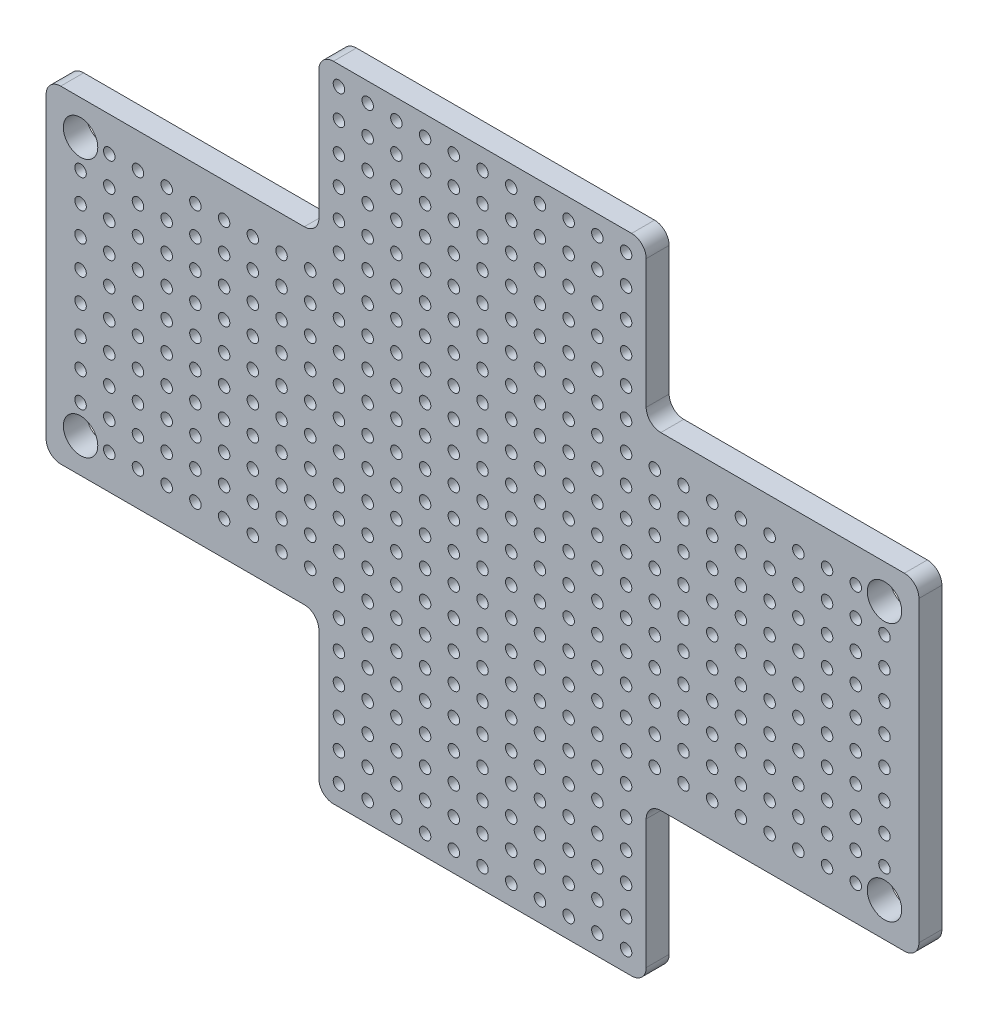
from build123d import *

# Parameters (mm, degrees)
SKETCH1_R           = 1.5
SKETCH1_R_2         = 0.5
BOSS_EXTRUDE1_DEPTH = 2
FILLET2_R           = 1.27


with BuildPart() as part:
    # Sketch1 → Boss-Extrude1 (new body)
    with BuildSketch(Plane.XY):
        Polygon((0, 0), (23.75, 0), (23.75, -13.75), (52.25, -13.75), (52.25, 0), (76, 0), (76, 28.5), (52.25, 28.5), (52.25, 42.25), (23.75, 42.25), (23.75, 28.5), (0, 28.5), align=None)
        with Locations((3, 25.5)):
            Circle(SKETCH1_R, mode=Mode.SUBTRACT)
        with Locations((73, 25.5)):
            Circle(SKETCH1_R, mode=Mode.SUBTRACT)
        with Locations((3, 3)):
            Circle(SKETCH1_R, mode=Mode.SUBTRACT)
        with Locations((73, 3)):
            Circle(SKETCH1_R, mode=Mode.SUBTRACT)
        with Locations((28, 38.04)):
            Circle(SKETCH1_R_2, mode=Mode.SUBTRACT)
        with Locations((5.5, 3)):
            Circle(SKETCH1_R_2, mode=Mode.SUBTRACT)
        with Locations((8, 3)):
            Circle(SKETCH1_R_2, mode=Mode.SUBTRACT)
        with Locations((10.5, 3)):
            Circle(SKETCH1_R_2, mode=Mode.SUBTRACT)
        with Locations((13, 3)):
            Circle(SKETCH1_R_2, mode=Mode.SUBTRACT)
        with Locations((15.5, 3)):
            Circle(SKETCH1_R_2, mode=Mode.SUBTRACT)
        with Locations((18, 3)):
            Circle(SKETCH1_R_2, mode=Mode.SUBTRACT)
        with Locations((20.5, 3)):
            Circle(SKETCH1_R_2, mode=Mode.SUBTRACT)
        with Locations((23, 3)):
            Circle(SKETCH1_R_2, mode=Mode.SUBTRACT)
        with Locations((25.5, 3)):
            Circle(SKETCH1_R_2, mode=Mode.SUBTRACT)
        with Locations((28, 3)):
            Circle(SKETCH1_R_2, mode=Mode.SUBTRACT)
        with Locations((30.5, 3)):
            Circle(SKETCH1_R_2, mode=Mode.SUBTRACT)
        with Locations((33, 3)):
            Circle(SKETCH1_R_2, mode=Mode.SUBTRACT)
        with Locations((35.5, 3)):
            Circle(SKETCH1_R_2, mode=Mode.SUBTRACT)
        with Locations((38, 3)):
            Circle(SKETCH1_R_2, mode=Mode.SUBTRACT)
        with Locations((40.5, 3)):
            Circle(SKETCH1_R_2, mode=Mode.SUBTRACT)
        with Locations((43, 3)):
            Circle(SKETCH1_R_2, mode=Mode.SUBTRACT)
        with Locations((45.5, 3)):
            Circle(SKETCH1_R_2, mode=Mode.SUBTRACT)
        with Locations((48, 3)):
            Circle(SKETCH1_R_2, mode=Mode.SUBTRACT)
        with Locations((50.5, 3)):
            Circle(SKETCH1_R_2, mode=Mode.SUBTRACT)
        with Locations((53, 3)):
            Circle(SKETCH1_R_2, mode=Mode.SUBTRACT)
        with Locations((55.5, 3)):
            Circle(SKETCH1_R_2, mode=Mode.SUBTRACT)
        with Locations((58, 3)):
            Circle(SKETCH1_R_2, mode=Mode.SUBTRACT)
        with Locations((60.5, 3)):
            Circle(SKETCH1_R_2, mode=Mode.SUBTRACT)
        with Locations((63, 3)):
            Circle(SKETCH1_R_2, mode=Mode.SUBTRACT)
        with Locations((65.5, 3)):
            Circle(SKETCH1_R_2, mode=Mode.SUBTRACT)
        with Locations((68, 3)):
            Circle(SKETCH1_R_2, mode=Mode.SUBTRACT)
        with Locations((70.5, 3)):
            Circle(SKETCH1_R_2, mode=Mode.SUBTRACT)
        with Locations((25.5, 38.04)):
            Circle(SKETCH1_R_2, mode=Mode.SUBTRACT)
        with Locations((5.5, 5.5)):
            Circle(SKETCH1_R_2, mode=Mode.SUBTRACT)
        with Locations((8, 5.5)):
            Circle(SKETCH1_R_2, mode=Mode.SUBTRACT)
        with Locations((10.5, 5.5)):
            Circle(SKETCH1_R_2, mode=Mode.SUBTRACT)
        with Locations((13, 5.5)):
            Circle(SKETCH1_R_2, mode=Mode.SUBTRACT)
        with Locations((15.5, 5.5)):
            Circle(SKETCH1_R_2, mode=Mode.SUBTRACT)
        with Locations((18, 5.5)):
            Circle(SKETCH1_R_2, mode=Mode.SUBTRACT)
        with Locations((20.5, 5.5)):
            Circle(SKETCH1_R_2, mode=Mode.SUBTRACT)
        with Locations((23, 5.5)):
            Circle(SKETCH1_R_2, mode=Mode.SUBTRACT)
        with Locations((25.5, 5.5)):
            Circle(SKETCH1_R_2, mode=Mode.SUBTRACT)
        with Locations((28, 5.5)):
            Circle(SKETCH1_R_2, mode=Mode.SUBTRACT)
        with Locations((30.5, 5.5)):
            Circle(SKETCH1_R_2, mode=Mode.SUBTRACT)
        with Locations((33, 5.5)):
            Circle(SKETCH1_R_2, mode=Mode.SUBTRACT)
        with Locations((35.5, 5.5)):
            Circle(SKETCH1_R_2, mode=Mode.SUBTRACT)
        with Locations((38, 5.5)):
            Circle(SKETCH1_R_2, mode=Mode.SUBTRACT)
        with Locations((40.5, 5.5)):
            Circle(SKETCH1_R_2, mode=Mode.SUBTRACT)
        with Locations((43, 5.5)):
            Circle(SKETCH1_R_2, mode=Mode.SUBTRACT)
        with Locations((45.5, 5.5)):
            Circle(SKETCH1_R_2, mode=Mode.SUBTRACT)
        with Locations((48, 5.5)):
            Circle(SKETCH1_R_2, mode=Mode.SUBTRACT)
        with Locations((50.5, 5.5)):
            Circle(SKETCH1_R_2, mode=Mode.SUBTRACT)
        with Locations((53, 5.5)):
            Circle(SKETCH1_R_2, mode=Mode.SUBTRACT)
        with Locations((55.5, 5.5)):
            Circle(SKETCH1_R_2, mode=Mode.SUBTRACT)
        with Locations((58, 5.5)):
            Circle(SKETCH1_R_2, mode=Mode.SUBTRACT)
        with Locations((60.5, 5.5)):
            Circle(SKETCH1_R_2, mode=Mode.SUBTRACT)
        with Locations((63, 5.5)):
            Circle(SKETCH1_R_2, mode=Mode.SUBTRACT)
        with Locations((65.5, 5.5)):
            Circle(SKETCH1_R_2, mode=Mode.SUBTRACT)
        with Locations((68, 5.5)):
            Circle(SKETCH1_R_2, mode=Mode.SUBTRACT)
        with Locations((70.5, 5.5)):
            Circle(SKETCH1_R_2, mode=Mode.SUBTRACT)
        with Locations((73, 5.5)):
            Circle(SKETCH1_R_2, mode=Mode.SUBTRACT)
        with Locations((5.5, 8)):
            Circle(SKETCH1_R_2, mode=Mode.SUBTRACT)
        with Locations((8, 8)):
            Circle(SKETCH1_R_2, mode=Mode.SUBTRACT)
        with Locations((10.5, 8)):
            Circle(SKETCH1_R_2, mode=Mode.SUBTRACT)
        with Locations((13, 8)):
            Circle(SKETCH1_R_2, mode=Mode.SUBTRACT)
        with Locations((15.5, 8)):
            Circle(SKETCH1_R_2, mode=Mode.SUBTRACT)
        with Locations((18, 8)):
            Circle(SKETCH1_R_2, mode=Mode.SUBTRACT)
        with Locations((20.5, 8)):
            Circle(SKETCH1_R_2, mode=Mode.SUBTRACT)
        with Locations((23, 8)):
            Circle(SKETCH1_R_2, mode=Mode.SUBTRACT)
        with Locations((25.5, 8)):
            Circle(SKETCH1_R_2, mode=Mode.SUBTRACT)
        with Locations((28, 8)):
            Circle(SKETCH1_R_2, mode=Mode.SUBTRACT)
        with Locations((30.5, 8)):
            Circle(SKETCH1_R_2, mode=Mode.SUBTRACT)
        with Locations((33, 8)):
            Circle(SKETCH1_R_2, mode=Mode.SUBTRACT)
        with Locations((35.5, 8)):
            Circle(SKETCH1_R_2, mode=Mode.SUBTRACT)
        with Locations((38, 8)):
            Circle(SKETCH1_R_2, mode=Mode.SUBTRACT)
        with Locations((40.5, 8)):
            Circle(SKETCH1_R_2, mode=Mode.SUBTRACT)
        with Locations((43, 8)):
            Circle(SKETCH1_R_2, mode=Mode.SUBTRACT)
        with Locations((45.5, 8)):
            Circle(SKETCH1_R_2, mode=Mode.SUBTRACT)
        with Locations((48, 8)):
            Circle(SKETCH1_R_2, mode=Mode.SUBTRACT)
        with Locations((50.5, 8)):
            Circle(SKETCH1_R_2, mode=Mode.SUBTRACT)
        with Locations((53, 8)):
            Circle(SKETCH1_R_2, mode=Mode.SUBTRACT)
        with Locations((55.5, 8)):
            Circle(SKETCH1_R_2, mode=Mode.SUBTRACT)
        with Locations((58, 8)):
            Circle(SKETCH1_R_2, mode=Mode.SUBTRACT)
        with Locations((60.5, 8)):
            Circle(SKETCH1_R_2, mode=Mode.SUBTRACT)
        with Locations((63, 8)):
            Circle(SKETCH1_R_2, mode=Mode.SUBTRACT)
        with Locations((65.5, 8)):
            Circle(SKETCH1_R_2, mode=Mode.SUBTRACT)
        with Locations((68, 8)):
            Circle(SKETCH1_R_2, mode=Mode.SUBTRACT)
        with Locations((70.5, 8)):
            Circle(SKETCH1_R_2, mode=Mode.SUBTRACT)
        with Locations((73, 8)):
            Circle(SKETCH1_R_2, mode=Mode.SUBTRACT)
        with Locations((5.5, 10.5)):
            Circle(SKETCH1_R_2, mode=Mode.SUBTRACT)
        with Locations((8, 10.5)):
            Circle(SKETCH1_R_2, mode=Mode.SUBTRACT)
        with Locations((10.5, 10.5)):
            Circle(SKETCH1_R_2, mode=Mode.SUBTRACT)
        with Locations((13, 10.5)):
            Circle(SKETCH1_R_2, mode=Mode.SUBTRACT)
        with Locations((15.5, 10.5)):
            Circle(SKETCH1_R_2, mode=Mode.SUBTRACT)
        with Locations((18, 10.5)):
            Circle(SKETCH1_R_2, mode=Mode.SUBTRACT)
        with Locations((20.5, 10.5)):
            Circle(SKETCH1_R_2, mode=Mode.SUBTRACT)
        with Locations((23, 10.5)):
            Circle(SKETCH1_R_2, mode=Mode.SUBTRACT)
        with Locations((25.5, 10.5)):
            Circle(SKETCH1_R_2, mode=Mode.SUBTRACT)
        with Locations((28, 10.5)):
            Circle(SKETCH1_R_2, mode=Mode.SUBTRACT)
        with Locations((30.5, 10.5)):
            Circle(SKETCH1_R_2, mode=Mode.SUBTRACT)
        with Locations((33, 10.5)):
            Circle(SKETCH1_R_2, mode=Mode.SUBTRACT)
        with Locations((35.5, 10.5)):
            Circle(SKETCH1_R_2, mode=Mode.SUBTRACT)
        with Locations((38, 10.5)):
            Circle(SKETCH1_R_2, mode=Mode.SUBTRACT)
        with Locations((40.5, 10.5)):
            Circle(SKETCH1_R_2, mode=Mode.SUBTRACT)
        with Locations((43, 10.5)):
            Circle(SKETCH1_R_2, mode=Mode.SUBTRACT)
        with Locations((45.5, 10.5)):
            Circle(SKETCH1_R_2, mode=Mode.SUBTRACT)
        with Locations((48, 10.5)):
            Circle(SKETCH1_R_2, mode=Mode.SUBTRACT)
        with Locations((50.5, 10.5)):
            Circle(SKETCH1_R_2, mode=Mode.SUBTRACT)
        with Locations((53, 10.5)):
            Circle(SKETCH1_R_2, mode=Mode.SUBTRACT)
        with Locations((55.5, 10.5)):
            Circle(SKETCH1_R_2, mode=Mode.SUBTRACT)
        with Locations((58, 10.5)):
            Circle(SKETCH1_R_2, mode=Mode.SUBTRACT)
        with Locations((60.5, 10.5)):
            Circle(SKETCH1_R_2, mode=Mode.SUBTRACT)
        with Locations((63, 10.5)):
            Circle(SKETCH1_R_2, mode=Mode.SUBTRACT)
        with Locations((65.5, 10.5)):
            Circle(SKETCH1_R_2, mode=Mode.SUBTRACT)
        with Locations((68, 10.5)):
            Circle(SKETCH1_R_2, mode=Mode.SUBTRACT)
        with Locations((70.5, 10.5)):
            Circle(SKETCH1_R_2, mode=Mode.SUBTRACT)
        with Locations((73, 10.5)):
            Circle(SKETCH1_R_2, mode=Mode.SUBTRACT)
        with Locations((5.5, 13)):
            Circle(SKETCH1_R_2, mode=Mode.SUBTRACT)
        with Locations((8, 13)):
            Circle(SKETCH1_R_2, mode=Mode.SUBTRACT)
        with Locations((10.5, 13)):
            Circle(SKETCH1_R_2, mode=Mode.SUBTRACT)
        with Locations((13, 13)):
            Circle(SKETCH1_R_2, mode=Mode.SUBTRACT)
        with Locations((15.5, 13)):
            Circle(SKETCH1_R_2, mode=Mode.SUBTRACT)
        with Locations((18, 13)):
            Circle(SKETCH1_R_2, mode=Mode.SUBTRACT)
        with Locations((20.5, 13)):
            Circle(SKETCH1_R_2, mode=Mode.SUBTRACT)
        with Locations((23, 13)):
            Circle(SKETCH1_R_2, mode=Mode.SUBTRACT)
        with Locations((25.5, 13)):
            Circle(SKETCH1_R_2, mode=Mode.SUBTRACT)
        with Locations((28, 13)):
            Circle(SKETCH1_R_2, mode=Mode.SUBTRACT)
        with Locations((30.5, 13)):
            Circle(SKETCH1_R_2, mode=Mode.SUBTRACT)
        with Locations((33, 13)):
            Circle(SKETCH1_R_2, mode=Mode.SUBTRACT)
        with Locations((35.5, 13)):
            Circle(SKETCH1_R_2, mode=Mode.SUBTRACT)
        with Locations((38, 13)):
            Circle(SKETCH1_R_2, mode=Mode.SUBTRACT)
        with Locations((40.5, 13)):
            Circle(SKETCH1_R_2, mode=Mode.SUBTRACT)
        with Locations((43, 13)):
            Circle(SKETCH1_R_2, mode=Mode.SUBTRACT)
        with Locations((45.5, 13)):
            Circle(SKETCH1_R_2, mode=Mode.SUBTRACT)
        with Locations((48, 13)):
            Circle(SKETCH1_R_2, mode=Mode.SUBTRACT)
        with Locations((50.5, 13)):
            Circle(SKETCH1_R_2, mode=Mode.SUBTRACT)
        with Locations((53, 13)):
            Circle(SKETCH1_R_2, mode=Mode.SUBTRACT)
        with Locations((55.5, 13)):
            Circle(SKETCH1_R_2, mode=Mode.SUBTRACT)
        with Locations((58, 13)):
            Circle(SKETCH1_R_2, mode=Mode.SUBTRACT)
        with Locations((60.5, 13)):
            Circle(SKETCH1_R_2, mode=Mode.SUBTRACT)
        with Locations((63, 13)):
            Circle(SKETCH1_R_2, mode=Mode.SUBTRACT)
        with Locations((65.5, 13)):
            Circle(SKETCH1_R_2, mode=Mode.SUBTRACT)
        with Locations((68, 13)):
            Circle(SKETCH1_R_2, mode=Mode.SUBTRACT)
        with Locations((70.5, 13)):
            Circle(SKETCH1_R_2, mode=Mode.SUBTRACT)
        with Locations((73, 13)):
            Circle(SKETCH1_R_2, mode=Mode.SUBTRACT)
        with Locations((5.5, 15.5)):
            Circle(SKETCH1_R_2, mode=Mode.SUBTRACT)
        with Locations((8, 15.5)):
            Circle(SKETCH1_R_2, mode=Mode.SUBTRACT)
        with Locations((10.5, 15.5)):
            Circle(SKETCH1_R_2, mode=Mode.SUBTRACT)
        with Locations((13, 15.5)):
            Circle(SKETCH1_R_2, mode=Mode.SUBTRACT)
        with Locations((15.5, 15.5)):
            Circle(SKETCH1_R_2, mode=Mode.SUBTRACT)
        with Locations((18, 15.5)):
            Circle(SKETCH1_R_2, mode=Mode.SUBTRACT)
        with Locations((20.5, 15.5)):
            Circle(SKETCH1_R_2, mode=Mode.SUBTRACT)
        with Locations((23, 15.5)):
            Circle(SKETCH1_R_2, mode=Mode.SUBTRACT)
        with Locations((25.5, 15.5)):
            Circle(SKETCH1_R_2, mode=Mode.SUBTRACT)
        with Locations((28, 15.5)):
            Circle(SKETCH1_R_2, mode=Mode.SUBTRACT)
        with Locations((30.5, 15.5)):
            Circle(SKETCH1_R_2, mode=Mode.SUBTRACT)
        with Locations((33, 15.5)):
            Circle(SKETCH1_R_2, mode=Mode.SUBTRACT)
        with Locations((35.5, 15.5)):
            Circle(SKETCH1_R_2, mode=Mode.SUBTRACT)
        with Locations((38, 15.5)):
            Circle(SKETCH1_R_2, mode=Mode.SUBTRACT)
        with Locations((40.5, 15.5)):
            Circle(SKETCH1_R_2, mode=Mode.SUBTRACT)
        with Locations((43, 15.5)):
            Circle(SKETCH1_R_2, mode=Mode.SUBTRACT)
        with Locations((45.5, 15.5)):
            Circle(SKETCH1_R_2, mode=Mode.SUBTRACT)
        with Locations((48, 15.5)):
            Circle(SKETCH1_R_2, mode=Mode.SUBTRACT)
        with Locations((50.5, 15.5)):
            Circle(SKETCH1_R_2, mode=Mode.SUBTRACT)
        with Locations((53, 15.5)):
            Circle(SKETCH1_R_2, mode=Mode.SUBTRACT)
        with Locations((55.5, 15.5)):
            Circle(SKETCH1_R_2, mode=Mode.SUBTRACT)
        with Locations((58, 15.5)):
            Circle(SKETCH1_R_2, mode=Mode.SUBTRACT)
        with Locations((60.5, 15.5)):
            Circle(SKETCH1_R_2, mode=Mode.SUBTRACT)
        with Locations((63, 15.5)):
            Circle(SKETCH1_R_2, mode=Mode.SUBTRACT)
        with Locations((65.5, 15.5)):
            Circle(SKETCH1_R_2, mode=Mode.SUBTRACT)
        with Locations((68, 15.5)):
            Circle(SKETCH1_R_2, mode=Mode.SUBTRACT)
        with Locations((70.5, 15.5)):
            Circle(SKETCH1_R_2, mode=Mode.SUBTRACT)
        with Locations((73, 15.5)):
            Circle(SKETCH1_R_2, mode=Mode.SUBTRACT)
        with Locations((5.5, 18)):
            Circle(SKETCH1_R_2, mode=Mode.SUBTRACT)
        with Locations((8, 18)):
            Circle(SKETCH1_R_2, mode=Mode.SUBTRACT)
        with Locations((10.5, 18)):
            Circle(SKETCH1_R_2, mode=Mode.SUBTRACT)
        with Locations((13, 18)):
            Circle(SKETCH1_R_2, mode=Mode.SUBTRACT)
        with Locations((15.5, 18)):
            Circle(SKETCH1_R_2, mode=Mode.SUBTRACT)
        with Locations((18, 18)):
            Circle(SKETCH1_R_2, mode=Mode.SUBTRACT)
        with Locations((20.5, 18)):
            Circle(SKETCH1_R_2, mode=Mode.SUBTRACT)
        with Locations((23, 18)):
            Circle(SKETCH1_R_2, mode=Mode.SUBTRACT)
        with Locations((25.5, 18)):
            Circle(SKETCH1_R_2, mode=Mode.SUBTRACT)
        with Locations((28, 18)):
            Circle(SKETCH1_R_2, mode=Mode.SUBTRACT)
        with Locations((30.5, 18)):
            Circle(SKETCH1_R_2, mode=Mode.SUBTRACT)
        with Locations((33, 18)):
            Circle(SKETCH1_R_2, mode=Mode.SUBTRACT)
        with Locations((35.5, 18)):
            Circle(SKETCH1_R_2, mode=Mode.SUBTRACT)
        with Locations((38, 18)):
            Circle(SKETCH1_R_2, mode=Mode.SUBTRACT)
        with Locations((40.5, 18)):
            Circle(SKETCH1_R_2, mode=Mode.SUBTRACT)
        with Locations((43, 18)):
            Circle(SKETCH1_R_2, mode=Mode.SUBTRACT)
        with Locations((45.5, 18)):
            Circle(SKETCH1_R_2, mode=Mode.SUBTRACT)
        with Locations((48, 18)):
            Circle(SKETCH1_R_2, mode=Mode.SUBTRACT)
        with Locations((50.5, 18)):
            Circle(SKETCH1_R_2, mode=Mode.SUBTRACT)
        with Locations((53, 18)):
            Circle(SKETCH1_R_2, mode=Mode.SUBTRACT)
        with Locations((55.5, 18)):
            Circle(SKETCH1_R_2, mode=Mode.SUBTRACT)
        with Locations((58, 18)):
            Circle(SKETCH1_R_2, mode=Mode.SUBTRACT)
        with Locations((60.5, 18)):
            Circle(SKETCH1_R_2, mode=Mode.SUBTRACT)
        with Locations((63, 18)):
            Circle(SKETCH1_R_2, mode=Mode.SUBTRACT)
        with Locations((65.5, 18)):
            Circle(SKETCH1_R_2, mode=Mode.SUBTRACT)
        with Locations((68, 18)):
            Circle(SKETCH1_R_2, mode=Mode.SUBTRACT)
        with Locations((70.5, 18)):
            Circle(SKETCH1_R_2, mode=Mode.SUBTRACT)
        with Locations((73, 18)):
            Circle(SKETCH1_R_2, mode=Mode.SUBTRACT)
        with Locations((5.5, 20.5)):
            Circle(SKETCH1_R_2, mode=Mode.SUBTRACT)
        with Locations((8, 20.5)):
            Circle(SKETCH1_R_2, mode=Mode.SUBTRACT)
        with Locations((10.5, 20.5)):
            Circle(SKETCH1_R_2, mode=Mode.SUBTRACT)
        with Locations((13, 20.5)):
            Circle(SKETCH1_R_2, mode=Mode.SUBTRACT)
        with Locations((15.5, 20.5)):
            Circle(SKETCH1_R_2, mode=Mode.SUBTRACT)
        with Locations((18, 20.5)):
            Circle(SKETCH1_R_2, mode=Mode.SUBTRACT)
        with Locations((20.5, 20.5)):
            Circle(SKETCH1_R_2, mode=Mode.SUBTRACT)
        with Locations((23, 20.5)):
            Circle(SKETCH1_R_2, mode=Mode.SUBTRACT)
        with Locations((25.5, 20.5)):
            Circle(SKETCH1_R_2, mode=Mode.SUBTRACT)
        with Locations((28, 20.5)):
            Circle(SKETCH1_R_2, mode=Mode.SUBTRACT)
        with Locations((30.5, 20.5)):
            Circle(SKETCH1_R_2, mode=Mode.SUBTRACT)
        with Locations((33, 20.5)):
            Circle(SKETCH1_R_2, mode=Mode.SUBTRACT)
        with Locations((35.5, 20.5)):
            Circle(SKETCH1_R_2, mode=Mode.SUBTRACT)
        with Locations((38, 20.5)):
            Circle(SKETCH1_R_2, mode=Mode.SUBTRACT)
        with Locations((40.5, 20.5)):
            Circle(SKETCH1_R_2, mode=Mode.SUBTRACT)
        with Locations((43, 20.5)):
            Circle(SKETCH1_R_2, mode=Mode.SUBTRACT)
        with Locations((45.5, 20.5)):
            Circle(SKETCH1_R_2, mode=Mode.SUBTRACT)
        with Locations((48, 20.5)):
            Circle(SKETCH1_R_2, mode=Mode.SUBTRACT)
        with Locations((50.5, 20.5)):
            Circle(SKETCH1_R_2, mode=Mode.SUBTRACT)
        with Locations((53, 20.5)):
            Circle(SKETCH1_R_2, mode=Mode.SUBTRACT)
        with Locations((55.5, 20.5)):
            Circle(SKETCH1_R_2, mode=Mode.SUBTRACT)
        with Locations((58, 20.5)):
            Circle(SKETCH1_R_2, mode=Mode.SUBTRACT)
        with Locations((60.5, 20.5)):
            Circle(SKETCH1_R_2, mode=Mode.SUBTRACT)
        with Locations((63, 20.5)):
            Circle(SKETCH1_R_2, mode=Mode.SUBTRACT)
        with Locations((65.5, 20.5)):
            Circle(SKETCH1_R_2, mode=Mode.SUBTRACT)
        with Locations((68, 20.5)):
            Circle(SKETCH1_R_2, mode=Mode.SUBTRACT)
        with Locations((70.5, 20.5)):
            Circle(SKETCH1_R_2, mode=Mode.SUBTRACT)
        with Locations((73, 20.5)):
            Circle(SKETCH1_R_2, mode=Mode.SUBTRACT)
        with Locations((5.5, 23)):
            Circle(SKETCH1_R_2, mode=Mode.SUBTRACT)
        with Locations((8, 23)):
            Circle(SKETCH1_R_2, mode=Mode.SUBTRACT)
        with Locations((10.5, 23)):
            Circle(SKETCH1_R_2, mode=Mode.SUBTRACT)
        with Locations((13, 23)):
            Circle(SKETCH1_R_2, mode=Mode.SUBTRACT)
        with Locations((15.5, 23)):
            Circle(SKETCH1_R_2, mode=Mode.SUBTRACT)
        with Locations((18, 23)):
            Circle(SKETCH1_R_2, mode=Mode.SUBTRACT)
        with Locations((20.5, 23)):
            Circle(SKETCH1_R_2, mode=Mode.SUBTRACT)
        with Locations((23, 23)):
            Circle(SKETCH1_R_2, mode=Mode.SUBTRACT)
        with Locations((25.5, 23)):
            Circle(SKETCH1_R_2, mode=Mode.SUBTRACT)
        with Locations((28, 23)):
            Circle(SKETCH1_R_2, mode=Mode.SUBTRACT)
        with Locations((30.5, 23)):
            Circle(SKETCH1_R_2, mode=Mode.SUBTRACT)
        with Locations((33, 23)):
            Circle(SKETCH1_R_2, mode=Mode.SUBTRACT)
        with Locations((35.5, 23)):
            Circle(SKETCH1_R_2, mode=Mode.SUBTRACT)
        with Locations((38, 23)):
            Circle(SKETCH1_R_2, mode=Mode.SUBTRACT)
        with Locations((40.5, 23)):
            Circle(SKETCH1_R_2, mode=Mode.SUBTRACT)
        with Locations((43, 23)):
            Circle(SKETCH1_R_2, mode=Mode.SUBTRACT)
        with Locations((45.5, 23)):
            Circle(SKETCH1_R_2, mode=Mode.SUBTRACT)
        with Locations((48, 23)):
            Circle(SKETCH1_R_2, mode=Mode.SUBTRACT)
        with Locations((50.5, 23)):
            Circle(SKETCH1_R_2, mode=Mode.SUBTRACT)
        with Locations((53, 23)):
            Circle(SKETCH1_R_2, mode=Mode.SUBTRACT)
        with Locations((55.5, 23)):
            Circle(SKETCH1_R_2, mode=Mode.SUBTRACT)
        with Locations((58, 23)):
            Circle(SKETCH1_R_2, mode=Mode.SUBTRACT)
        with Locations((60.5, 23)):
            Circle(SKETCH1_R_2, mode=Mode.SUBTRACT)
        with Locations((63, 23)):
            Circle(SKETCH1_R_2, mode=Mode.SUBTRACT)
        with Locations((65.5, 23)):
            Circle(SKETCH1_R_2, mode=Mode.SUBTRACT)
        with Locations((68, 23)):
            Circle(SKETCH1_R_2, mode=Mode.SUBTRACT)
        with Locations((70.5, 23)):
            Circle(SKETCH1_R_2, mode=Mode.SUBTRACT)
        with Locations((73, 23)):
            Circle(SKETCH1_R_2, mode=Mode.SUBTRACT)
        with Locations((5.5, 25.5)):
            Circle(SKETCH1_R_2, mode=Mode.SUBTRACT)
        with Locations((8, 25.5)):
            Circle(SKETCH1_R_2, mode=Mode.SUBTRACT)
        with Locations((10.5, 25.5)):
            Circle(SKETCH1_R_2, mode=Mode.SUBTRACT)
        with Locations((13, 25.5)):
            Circle(SKETCH1_R_2, mode=Mode.SUBTRACT)
        with Locations((15.5, 25.5)):
            Circle(SKETCH1_R_2, mode=Mode.SUBTRACT)
        with Locations((18, 25.5)):
            Circle(SKETCH1_R_2, mode=Mode.SUBTRACT)
        with Locations((20.5, 25.5)):
            Circle(SKETCH1_R_2, mode=Mode.SUBTRACT)
        with Locations((23, 25.5)):
            Circle(SKETCH1_R_2, mode=Mode.SUBTRACT)
        with Locations((25.5, 25.5)):
            Circle(SKETCH1_R_2, mode=Mode.SUBTRACT)
        with Locations((28, 25.5)):
            Circle(SKETCH1_R_2, mode=Mode.SUBTRACT)
        with Locations((30.5, 25.5)):
            Circle(SKETCH1_R_2, mode=Mode.SUBTRACT)
        with Locations((33, 25.5)):
            Circle(SKETCH1_R_2, mode=Mode.SUBTRACT)
        with Locations((35.5, 25.5)):
            Circle(SKETCH1_R_2, mode=Mode.SUBTRACT)
        with Locations((38, 25.5)):
            Circle(SKETCH1_R_2, mode=Mode.SUBTRACT)
        with Locations((40.5, 25.5)):
            Circle(SKETCH1_R_2, mode=Mode.SUBTRACT)
        with Locations((43, 25.5)):
            Circle(SKETCH1_R_2, mode=Mode.SUBTRACT)
        with Locations((45.5, 25.5)):
            Circle(SKETCH1_R_2, mode=Mode.SUBTRACT)
        with Locations((48, 25.5)):
            Circle(SKETCH1_R_2, mode=Mode.SUBTRACT)
        with Locations((50.5, 25.5)):
            Circle(SKETCH1_R_2, mode=Mode.SUBTRACT)
        with Locations((53, 25.5)):
            Circle(SKETCH1_R_2, mode=Mode.SUBTRACT)
        with Locations((55.5, 25.5)):
            Circle(SKETCH1_R_2, mode=Mode.SUBTRACT)
        with Locations((58, 25.5)):
            Circle(SKETCH1_R_2, mode=Mode.SUBTRACT)
        with Locations((60.5, 25.5)):
            Circle(SKETCH1_R_2, mode=Mode.SUBTRACT)
        with Locations((63, 25.5)):
            Circle(SKETCH1_R_2, mode=Mode.SUBTRACT)
        with Locations((65.5, 25.5)):
            Circle(SKETCH1_R_2, mode=Mode.SUBTRACT)
        with Locations((68, 25.5)):
            Circle(SKETCH1_R_2, mode=Mode.SUBTRACT)
        with Locations((70.5, 25.5)):
            Circle(SKETCH1_R_2, mode=Mode.SUBTRACT)
        with Locations((28, 40.58)):
            Circle(SKETCH1_R_2, mode=Mode.SUBTRACT)
        with Locations((3, 5.5)):
            Circle(SKETCH1_R_2, mode=Mode.SUBTRACT)
        with Locations((3, 8)):
            Circle(SKETCH1_R_2, mode=Mode.SUBTRACT)
        with Locations((3, 10.5)):
            Circle(SKETCH1_R_2, mode=Mode.SUBTRACT)
        with Locations((3, 13)):
            Circle(SKETCH1_R_2, mode=Mode.SUBTRACT)
        with Locations((3, 15.5)):
            Circle(SKETCH1_R_2, mode=Mode.SUBTRACT)
        with Locations((3, 18)):
            Circle(SKETCH1_R_2, mode=Mode.SUBTRACT)
        with Locations((3, 20.5)):
            Circle(SKETCH1_R_2, mode=Mode.SUBTRACT)
        with Locations((3, 23)):
            Circle(SKETCH1_R_2, mode=Mode.SUBTRACT)
        with Locations((25.5, 40.58)):
            Circle(SKETCH1_R_2, mode=Mode.SUBTRACT)
        with Locations((25.5, 28)):
            Circle(SKETCH1_R_2, mode=Mode.SUBTRACT)
        with Locations((28, 28)):
            Circle(SKETCH1_R_2, mode=Mode.SUBTRACT)
        with Locations((30.5, 28)):
            Circle(SKETCH1_R_2, mode=Mode.SUBTRACT)
        with Locations((33, 28)):
            Circle(SKETCH1_R_2, mode=Mode.SUBTRACT)
        with Locations((35.5, 28)):
            Circle(SKETCH1_R_2, mode=Mode.SUBTRACT)
        with Locations((38, 28)):
            Circle(SKETCH1_R_2, mode=Mode.SUBTRACT)
        with Locations((40.5, 28)):
            Circle(SKETCH1_R_2, mode=Mode.SUBTRACT)
        with Locations((43, 28)):
            Circle(SKETCH1_R_2, mode=Mode.SUBTRACT)
        with Locations((45.5, 28)):
            Circle(SKETCH1_R_2, mode=Mode.SUBTRACT)
        with Locations((48, 28)):
            Circle(SKETCH1_R_2, mode=Mode.SUBTRACT)
        with Locations((50.5, 28)):
            Circle(SKETCH1_R_2, mode=Mode.SUBTRACT)
        with Locations((25.5, 30.5)):
            Circle(SKETCH1_R_2, mode=Mode.SUBTRACT)
        with Locations((28, 30.5)):
            Circle(SKETCH1_R_2, mode=Mode.SUBTRACT)
        with Locations((30.5, 30.5)):
            Circle(SKETCH1_R_2, mode=Mode.SUBTRACT)
        with Locations((33, 30.5)):
            Circle(SKETCH1_R_2, mode=Mode.SUBTRACT)
        with Locations((35.5, 30.5)):
            Circle(SKETCH1_R_2, mode=Mode.SUBTRACT)
        with Locations((38, 30.5)):
            Circle(SKETCH1_R_2, mode=Mode.SUBTRACT)
        with Locations((40.5, 30.5)):
            Circle(SKETCH1_R_2, mode=Mode.SUBTRACT)
        with Locations((43, 30.5)):
            Circle(SKETCH1_R_2, mode=Mode.SUBTRACT)
        with Locations((45.5, 30.5)):
            Circle(SKETCH1_R_2, mode=Mode.SUBTRACT)
        with Locations((48, 30.5)):
            Circle(SKETCH1_R_2, mode=Mode.SUBTRACT)
        with Locations((50.5, 30.5)):
            Circle(SKETCH1_R_2, mode=Mode.SUBTRACT)
        with Locations((25.5, 33)):
            Circle(SKETCH1_R_2, mode=Mode.SUBTRACT)
        with Locations((28, 33)):
            Circle(SKETCH1_R_2, mode=Mode.SUBTRACT)
        with Locations((30.5, 33)):
            Circle(SKETCH1_R_2, mode=Mode.SUBTRACT)
        with Locations((33, 33)):
            Circle(SKETCH1_R_2, mode=Mode.SUBTRACT)
        with Locations((35.5, 33)):
            Circle(SKETCH1_R_2, mode=Mode.SUBTRACT)
        with Locations((38, 33)):
            Circle(SKETCH1_R_2, mode=Mode.SUBTRACT)
        with Locations((40.5, 33)):
            Circle(SKETCH1_R_2, mode=Mode.SUBTRACT)
        with Locations((43, 33)):
            Circle(SKETCH1_R_2, mode=Mode.SUBTRACT)
        with Locations((45.5, 33)):
            Circle(SKETCH1_R_2, mode=Mode.SUBTRACT)
        with Locations((48, 33)):
            Circle(SKETCH1_R_2, mode=Mode.SUBTRACT)
        with Locations((50.5, 33)):
            Circle(SKETCH1_R_2, mode=Mode.SUBTRACT)
        with Locations((25.5, 35.5)):
            Circle(SKETCH1_R_2, mode=Mode.SUBTRACT)
        with Locations((28, 35.5)):
            Circle(SKETCH1_R_2, mode=Mode.SUBTRACT)
        with Locations((30.5, 35.5)):
            Circle(SKETCH1_R_2, mode=Mode.SUBTRACT)
        with Locations((33, 35.5)):
            Circle(SKETCH1_R_2, mode=Mode.SUBTRACT)
        with Locations((35.5, 35.5)):
            Circle(SKETCH1_R_2, mode=Mode.SUBTRACT)
        with Locations((38, 35.5)):
            Circle(SKETCH1_R_2, mode=Mode.SUBTRACT)
        with Locations((40.5, 35.5)):
            Circle(SKETCH1_R_2, mode=Mode.SUBTRACT)
        with Locations((43, 35.5)):
            Circle(SKETCH1_R_2, mode=Mode.SUBTRACT)
        with Locations((45.5, 35.5)):
            Circle(SKETCH1_R_2, mode=Mode.SUBTRACT)
        with Locations((48, 35.5)):
            Circle(SKETCH1_R_2, mode=Mode.SUBTRACT)
        with Locations((50.5, 35.5)):
            Circle(SKETCH1_R_2, mode=Mode.SUBTRACT)
        with Locations((50.5, 38.04)):
            Circle(SKETCH1_R_2, mode=Mode.SUBTRACT)
        with Locations((48, 38.04)):
            Circle(SKETCH1_R_2, mode=Mode.SUBTRACT)
        with Locations((30.5, 38)):
            Circle(SKETCH1_R_2, mode=Mode.SUBTRACT)
        with Locations((33, 38)):
            Circle(SKETCH1_R_2, mode=Mode.SUBTRACT)
        with Locations((35.5, 38)):
            Circle(SKETCH1_R_2, mode=Mode.SUBTRACT)
        with Locations((38, 38)):
            Circle(SKETCH1_R_2, mode=Mode.SUBTRACT)
        with Locations((40.5, 38)):
            Circle(SKETCH1_R_2, mode=Mode.SUBTRACT)
        with Locations((43, 38)):
            Circle(SKETCH1_R_2, mode=Mode.SUBTRACT)
        with Locations((45.5, 38)):
            Circle(SKETCH1_R_2, mode=Mode.SUBTRACT)
        with Locations((50.5, 40.58)):
            Circle(SKETCH1_R_2, mode=Mode.SUBTRACT)
        with Locations((48, 40.58)):
            Circle(SKETCH1_R_2, mode=Mode.SUBTRACT)
        with Locations((30.5, 40.5)):
            Circle(SKETCH1_R_2, mode=Mode.SUBTRACT)
        with Locations((33, 40.5)):
            Circle(SKETCH1_R_2, mode=Mode.SUBTRACT)
        with Locations((35.5, 40.5)):
            Circle(SKETCH1_R_2, mode=Mode.SUBTRACT)
        with Locations((38, 40.5)):
            Circle(SKETCH1_R_2, mode=Mode.SUBTRACT)
        with Locations((40.5, 40.5)):
            Circle(SKETCH1_R_2, mode=Mode.SUBTRACT)
        with Locations((43, 40.5)):
            Circle(SKETCH1_R_2, mode=Mode.SUBTRACT)
        with Locations((45.5, 40.5)):
            Circle(SKETCH1_R_2, mode=Mode.SUBTRACT)
        with Locations((25.5, -12)):
            Circle(SKETCH1_R_2, mode=Mode.SUBTRACT)
        with Locations((25.5, -9.5)):
            Circle(SKETCH1_R_2, mode=Mode.SUBTRACT)
        with Locations((25.5, -7)):
            Circle(SKETCH1_R_2, mode=Mode.SUBTRACT)
        with Locations((25.5, -4.5)):
            Circle(SKETCH1_R_2, mode=Mode.SUBTRACT)
        with Locations((25.5, -2)):
            Circle(SKETCH1_R_2, mode=Mode.SUBTRACT)
        with Locations((25.5, 0.5)):
            Circle(SKETCH1_R_2, mode=Mode.SUBTRACT)
        with Locations((50.5, -12)):
            Circle(SKETCH1_R_2, mode=Mode.SUBTRACT)
        with Locations((48, -12)):
            Circle(SKETCH1_R_2, mode=Mode.SUBTRACT)
        with Locations((45.5, -12)):
            Circle(SKETCH1_R_2, mode=Mode.SUBTRACT)
        with Locations((43, -12)):
            Circle(SKETCH1_R_2, mode=Mode.SUBTRACT)
        with Locations((40.5, -12)):
            Circle(SKETCH1_R_2, mode=Mode.SUBTRACT)
        with Locations((38, -12)):
            Circle(SKETCH1_R_2, mode=Mode.SUBTRACT)
        with Locations((35.5, -12)):
            Circle(SKETCH1_R_2, mode=Mode.SUBTRACT)
        with Locations((33, -12)):
            Circle(SKETCH1_R_2, mode=Mode.SUBTRACT)
        with Locations((30.5, -12)):
            Circle(SKETCH1_R_2, mode=Mode.SUBTRACT)
        with Locations((28, -12)):
            Circle(SKETCH1_R_2, mode=Mode.SUBTRACT)
        with Locations((50.5, -9.5)):
            Circle(SKETCH1_R_2, mode=Mode.SUBTRACT)
        with Locations((48, -9.5)):
            Circle(SKETCH1_R_2, mode=Mode.SUBTRACT)
        with Locations((45.5, -9.5)):
            Circle(SKETCH1_R_2, mode=Mode.SUBTRACT)
        with Locations((43, -9.5)):
            Circle(SKETCH1_R_2, mode=Mode.SUBTRACT)
        with Locations((40.5, -9.5)):
            Circle(SKETCH1_R_2, mode=Mode.SUBTRACT)
        with Locations((38, -9.5)):
            Circle(SKETCH1_R_2, mode=Mode.SUBTRACT)
        with Locations((35.5, -9.5)):
            Circle(SKETCH1_R_2, mode=Mode.SUBTRACT)
        with Locations((33, -9.5)):
            Circle(SKETCH1_R_2, mode=Mode.SUBTRACT)
        with Locations((30.5, -9.5)):
            Circle(SKETCH1_R_2, mode=Mode.SUBTRACT)
        with Locations((28, -9.5)):
            Circle(SKETCH1_R_2, mode=Mode.SUBTRACT)
        with Locations((50.5, -7)):
            Circle(SKETCH1_R_2, mode=Mode.SUBTRACT)
        with Locations((48, -7)):
            Circle(SKETCH1_R_2, mode=Mode.SUBTRACT)
        with Locations((45.5, -7)):
            Circle(SKETCH1_R_2, mode=Mode.SUBTRACT)
        with Locations((43, -7)):
            Circle(SKETCH1_R_2, mode=Mode.SUBTRACT)
        with Locations((40.5, -7)):
            Circle(SKETCH1_R_2, mode=Mode.SUBTRACT)
        with Locations((38, -7)):
            Circle(SKETCH1_R_2, mode=Mode.SUBTRACT)
        with Locations((35.5, -7)):
            Circle(SKETCH1_R_2, mode=Mode.SUBTRACT)
        with Locations((33, -7)):
            Circle(SKETCH1_R_2, mode=Mode.SUBTRACT)
        with Locations((30.5, -7)):
            Circle(SKETCH1_R_2, mode=Mode.SUBTRACT)
        with Locations((28, -7)):
            Circle(SKETCH1_R_2, mode=Mode.SUBTRACT)
        with Locations((50.5, -4.5)):
            Circle(SKETCH1_R_2, mode=Mode.SUBTRACT)
        with Locations((48, -4.5)):
            Circle(SKETCH1_R_2, mode=Mode.SUBTRACT)
        with Locations((45.5, -4.5)):
            Circle(SKETCH1_R_2, mode=Mode.SUBTRACT)
        with Locations((43, -4.5)):
            Circle(SKETCH1_R_2, mode=Mode.SUBTRACT)
        with Locations((40.5, -4.5)):
            Circle(SKETCH1_R_2, mode=Mode.SUBTRACT)
        with Locations((38, -4.5)):
            Circle(SKETCH1_R_2, mode=Mode.SUBTRACT)
        with Locations((35.5, -4.5)):
            Circle(SKETCH1_R_2, mode=Mode.SUBTRACT)
        with Locations((33, -4.5)):
            Circle(SKETCH1_R_2, mode=Mode.SUBTRACT)
        with Locations((30.5, -4.5)):
            Circle(SKETCH1_R_2, mode=Mode.SUBTRACT)
        with Locations((28, -4.5)):
            Circle(SKETCH1_R_2, mode=Mode.SUBTRACT)
        with Locations((50.5, -2)):
            Circle(SKETCH1_R_2, mode=Mode.SUBTRACT)
        with Locations((48, -2)):
            Circle(SKETCH1_R_2, mode=Mode.SUBTRACT)
        with Locations((45.5, -2)):
            Circle(SKETCH1_R_2, mode=Mode.SUBTRACT)
        with Locations((43, -2)):
            Circle(SKETCH1_R_2, mode=Mode.SUBTRACT)
        with Locations((40.5, -2)):
            Circle(SKETCH1_R_2, mode=Mode.SUBTRACT)
        with Locations((38, -2)):
            Circle(SKETCH1_R_2, mode=Mode.SUBTRACT)
        with Locations((35.5, -2)):
            Circle(SKETCH1_R_2, mode=Mode.SUBTRACT)
        with Locations((33, -2)):
            Circle(SKETCH1_R_2, mode=Mode.SUBTRACT)
        with Locations((30.5, -2)):
            Circle(SKETCH1_R_2, mode=Mode.SUBTRACT)
        with Locations((28, -2)):
            Circle(SKETCH1_R_2, mode=Mode.SUBTRACT)
        with Locations((50.5, 0.5)):
            Circle(SKETCH1_R_2, mode=Mode.SUBTRACT)
        with Locations((48, 0.5)):
            Circle(SKETCH1_R_2, mode=Mode.SUBTRACT)
        with Locations((45.5, 0.5)):
            Circle(SKETCH1_R_2, mode=Mode.SUBTRACT)
        with Locations((43, 0.5)):
            Circle(SKETCH1_R_2, mode=Mode.SUBTRACT)
        with Locations((40.5, 0.5)):
            Circle(SKETCH1_R_2, mode=Mode.SUBTRACT)
        with Locations((38, 0.5)):
            Circle(SKETCH1_R_2, mode=Mode.SUBTRACT)
        with Locations((35.5, 0.5)):
            Circle(SKETCH1_R_2, mode=Mode.SUBTRACT)
        with Locations((33, 0.5)):
            Circle(SKETCH1_R_2, mode=Mode.SUBTRACT)
        with Locations((30.5, 0.5)):
            Circle(SKETCH1_R_2, mode=Mode.SUBTRACT)
        with Locations((28, 0.5)):
            Circle(SKETCH1_R_2, mode=Mode.SUBTRACT)
    extrude(amount=BOSS_EXTRUDE1_DEPTH)

    # Fillet2
    fillet2_edges = [part.edges().sort_by_distance(p)[0] for p in [
        (0, 0, 1),
        (23.75, 0, 1),
        (23.75, -13.75, 1),
        (52.25, -13.75, 1),
        (52.25, 0, 1),
        (76, 0, 1),
        (76, 28.5, 1),
        (52.25, 28.5, 1),
        (52.25, 42.25, 1),
        (23.75, 42.25, 1),
        (23.75, 28.5, 1),
        (0, 28.5, 1),
    ]]
    fillet(fillet2_edges, radius=FILLET2_R)


solid = part.part
